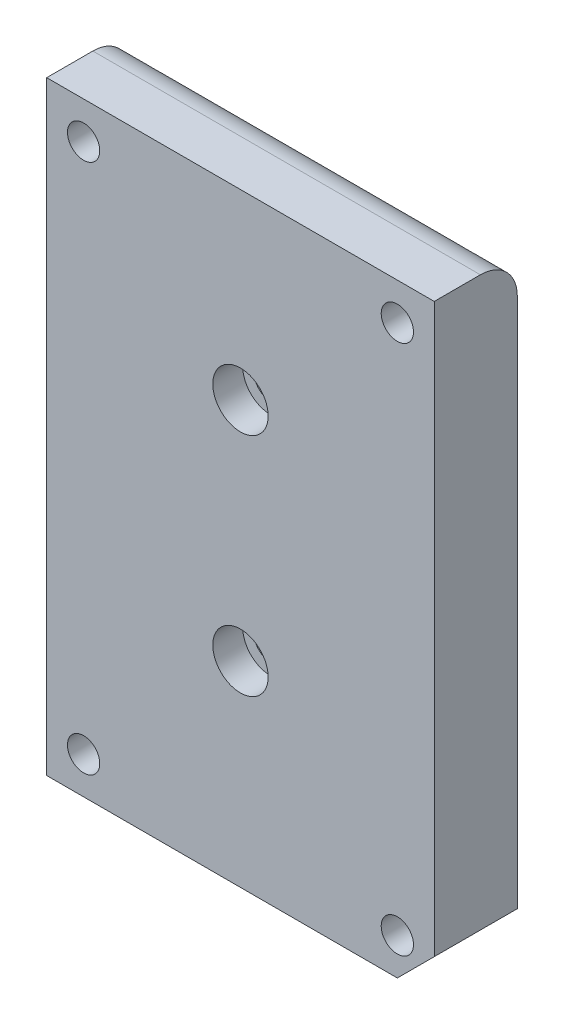
from build123d import *

# Parameters (mm, degrees)
SKETCH1_W           = 42
SKETCH1_H           = 65.5
BOSS_EXTRUDE1_DEPTH = 9
CUT_EXTRUDE2_DEPTH  = 4.5
SKETCH3_R           = 1.75
CUT_EXTRUDE5_DEPTH  = 78.939078773
SKETCH5_R           = 3
CUT_EXTRUDE6_DEPTH  = 3.25
FILLET1_R           = 4
SKETCH6_R           = 1.75
CUT_EXTRUDE7_DEPTH  = 79.327836687
SKETCH7_R           = 3
CUT_EXTRUDE8_DEPTH  = 3
CUT_EXTRUDE9_DEPTH  = 79.327836835
FILLET3_R           = 0.5


with BuildPart() as part:
    # Sketch1 → Boss-Extrude1 (new body)
    with BuildSketch(Plane.XY):
        with Locations((21, 32.75)):
            Rectangle(SKETCH1_W, SKETCH1_H)
    extrude(amount=BOSS_EXTRUDE1_DEPTH)

    # Sketch2 → Cut-Extrude2 (cut)
    with BuildSketch(Plane(origin=(0, 0, 0), x_dir=(-1, 0, 0), z_dir=(0, 0, -1))):
        with BuildLine():
            Line((-25.5, 21.25), (-25.5, 35.084635496))
            ThreePointArc((-25.5, 35.084635496), (-25.998538124, 38.202683318), (-27.444444444, 41.009837998))
            ThreePointArc((-27.444444444, 41.009837998), (-21, 53.75), (-14.555555556, 41.009837998))
            ThreePointArc((-14.555555556, 41.009837998), (-16.001461876, 38.202683318), (-16.5, 35.084635496))
            Line((-16.5, 35.084635496), (-16.5, 21.25))
            ThreePointArc((-16.5, 21.25), (-21, 16.75), (-25.5, 21.25))
        make_face()
    extrude(amount=-CUT_EXTRUDE2_DEPTH, mode=Mode.SUBTRACT)

    # Sketch3 → Cut-Extrude5 (cut, through all)
    with BuildSketch(Plane(origin=(0, 0, 4.5), x_dir=(-1, 0, 0), z_dir=(0, 0, -1))):
        with Locations((-21, 21.25)):
            Circle(SKETCH3_R)
        with Locations((-21, 45.75)):
            Circle(SKETCH3_R)
    extrude(amount=-CUT_EXTRUDE5_DEPTH, mode=Mode.SUBTRACT)

    # Sketch5 → Cut-Extrude6 (cut)
    with BuildSketch(Plane.XY.offset(9)):
        with Locations((21, 21.25)):
            Circle(SKETCH5_R)
        with Locations((21, 45.75)):
            Circle(SKETCH5_R)
    extrude(amount=-CUT_EXTRUDE6_DEPTH, mode=Mode.SUBTRACT)

    # Fillet1
    fillet1_edges = [part.edges().sort_by_distance(p)[0] for p in [
        (21, 0, 0),
        (21, 65.5, 0),
    ]]
    fillet(fillet1_edges, radius=FILLET1_R)

    # Sketch6 → Cut-Extrude7 (cut, through all)
    with BuildSketch(Plane(origin=(0, 0, 0), x_dir=(-1, 0, 0), z_dir=(0, 0, -1))):
        with Locations((-38, 61.5)):
            Circle(SKETCH6_R)
        with Locations((-4, 61.5)):
            Circle(SKETCH6_R)
        with Locations((-4, 4)):
            Circle(SKETCH6_R)
        with Locations((-38, 4)):
            Circle(SKETCH6_R)
    extrude(amount=-CUT_EXTRUDE7_DEPTH, mode=Mode.SUBTRACT)

    # Sketch7 → Cut-Extrude8 (cut)
    with BuildSketch(Plane(origin=(0, 0, 0), x_dir=(-1, 0, 0), z_dir=(0, 0, -1))):
        with Locations((-38, 61.5)):
            Circle(SKETCH7_R)
        with Locations((-4, 61.5)):
            Circle(SKETCH7_R)
        with Locations((-4, 4)):
            Circle(SKETCH7_R)
        with Locations((-38, 4)):
            Circle(SKETCH7_R)
    extrude(amount=-CUT_EXTRUDE8_DEPTH, mode=Mode.SUBTRACT)

    # Sketch8 → Cut-Extrude9 (cut, through all)
    with BuildSketch(Plane.XY.offset(9)):
        Polygon((42, 0), (38, 0), (42, 4), align=None)
    extrude(amount=-CUT_EXTRUDE9_DEPTH, mode=Mode.SUBTRACT)

    # Fillet3
    fillet3_edges = [part.edges().sort_by_distance(p)[0] for p in [
        (39.292893219, 1.292893219, 2.027623277),
        (40.707106781, 2.707106781, 1.607354553),
    ]]
    fillet(fillet3_edges, radius=FILLET3_R)


solid = part.part
